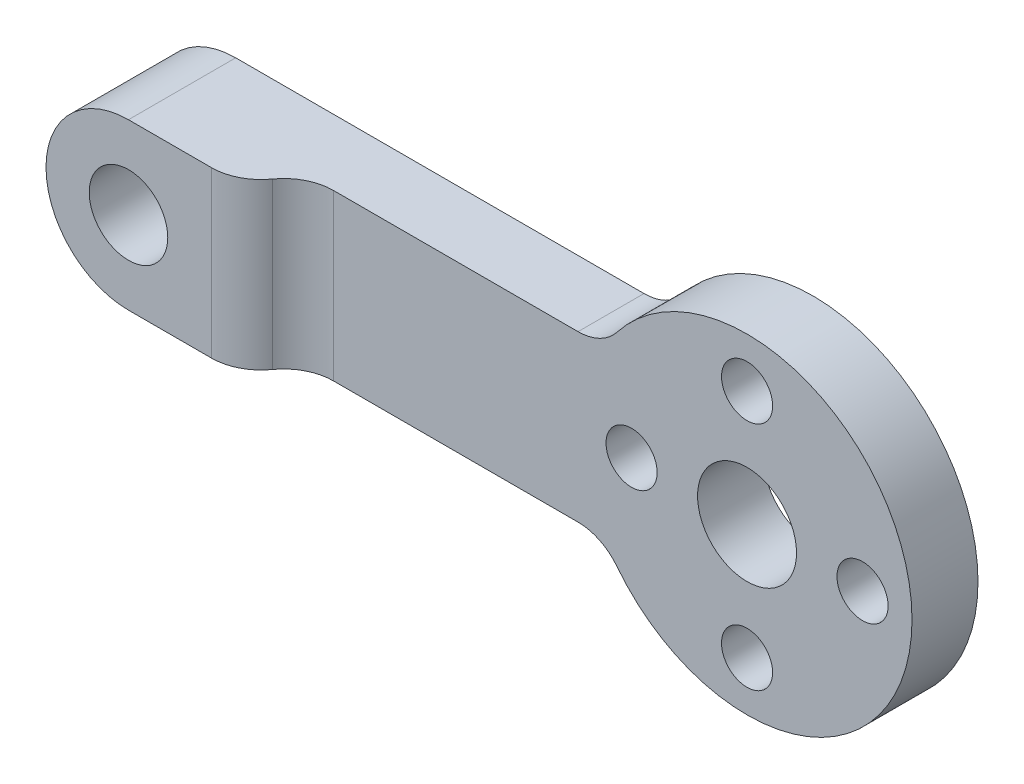
from build123d import *

# Parameters (mm, degrees)
BOSS_EXTRUDE3_DEPTH = 6.5
SKETCH9_R           = 2.38125
SKETCH9_R_2         = 3
SKETCH9_R_3         = 1.55
CUT_EXTRUDE4_DEPTH  = 6.5
SKETCH10_W          = 37
SKETCH10_H          = 2.5
CUT_EXTRUDE5_DEPTH  = 15
FILLET6_R           = 3
FILLET7_R           = 3
FILLET8_RADIUS      = 5
FILLET8_LENGTH      = 6.5


with BuildPart() as part:
    # Sketch8 → Boss-Extrude3 (new body)
    with BuildSketch(Plane.XY):
        with BuildLine():
            Line((-25, -5), (6.339745962, -5))
            ThreePointArc((6.339745962, -5), (25, 0), (6.339745962, 5))
            Line((6.339745962, 5), (-25, 5))
            Line((-25, 5), (-25, -5))
        make_face()
    extrude(amount=BOSS_EXTRUDE3_DEPTH)

    # Sketch9 → Cut-Extrude4 (cut)
    with BuildSketch(Plane.XY.offset(6.5)):
        with Locations((-20, 0)):
            Circle(SKETCH9_R)
        with Locations((15, 0)):
            Circle(SKETCH9_R_2)
        with Locations((22, 0)):
            Circle(SKETCH9_R_3)
        with Locations((15, -7)):
            Circle(SKETCH9_R_3)
        with Locations((8, 0)):
            Circle(SKETCH9_R_3)
        with Locations((15, 7)):
            Circle(SKETCH9_R_3)
    extrude(amount=-CUT_EXTRUDE4_DEPTH, mode=Mode.SUBTRACT)

    # Sketch10 → Cut-Extrude5 (cut, symmetric)
    with BuildSketch(Plane(origin=(0, 0, 0), x_dir=(1, 0, 0), z_dir=(0, 1, 0))):
        with Locations((6.5, -5.25)):
            Rectangle(SKETCH10_W, SKETCH10_H)
    extrude(amount=CUT_EXTRUDE5_DEPTH, both=True, mode=Mode.SUBTRACT)

    # Fillet6
    # the kernel refuses this fillet: 3 mm, written as the material it takes off along each edge
    with BuildSketch(Plane(origin=(-12, 12.395099729, 6.5), x_dir=(0, 0, -1), z_dir=(0, -1, 0))) as fillet6_piece_1:
        with BuildLine():
            CenterArc((3, -2.958039892), FILLET6_R, 99.594068227, 80.405931773)
            Line((0, -2.958039892), (-0.06, -2.958039892))
            Line((-0.06, -2.958039892), (-0.06, 0))
            Line((-0.06, 0), (0, 0.06))
            ThreePointArc((0, 0.06), (1.25, 0.06), (2.49, 0.059160798))
            Line((2.49, 0.059160798), (2.5, 0))
        make_face()
    extrude(amount=24.790199458, mode=Mode.SUBTRACT)

    # Fillet7
    fillet7_edges = [part.edges().sort_by_distance(p)[0] for p in [
        (6.339745962, -5, 2),
        (6.339745962, 5, 2),
        (-12, 0, 4),
    ]]
    fillet(fillet7_edges, radius=FILLET7_R)

    # Fillet8: full round fillet: the end face becomes a half cylinder, R = half its width
    fillet8_face = Plane((-25, 0, 3.25), x_dir=(0, 0, 1), z_dir=(-1, 0, 0))  # on the end face: x along it, z out of the body
    fillet8_slab = fillet8_face.offset(-FILLET8_RADIUS / 2) * Box(FILLET8_LENGTH, 2 * FILLET8_RADIUS, FILLET8_RADIUS, mode=Mode.PRIVATE)  # the body's end, R deep
    fillet8_round = Plane((-20, 0, 3.25), x_dir=(-1, 0, 0), z_dir=(0, 0, 1)) * Cylinder(FILLET8_RADIUS, FILLET8_LENGTH, mode=Mode.PRIVATE)  # its axis R under the face
    add(fillet8_slab - fillet8_round, mode=Mode.SUBTRACT)


solid = part.part
